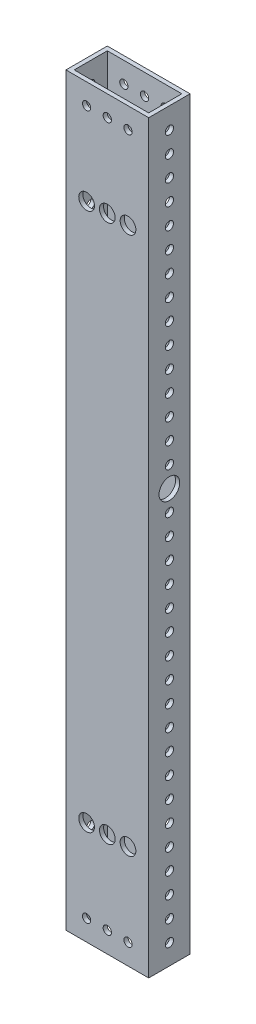
from build123d import *

# Parameters (mm, degrees)
SKETCH1_W           = 50.8
SKETCH1_H           = 25.4
SKETCH1_W_2         = 45.72
SKETCH1_H_2         = 20.32
BOSS_EXTRUDE1_DEPTH = 457.2
SKETCH3_R           = 2.54
SKETCH3_R_2         = 6.35
CUT_EXTRUDE1_DEPTH  = 457.2
SKETCH4_R           = 2.54
SKETCH4_R_2         = 4.826
CUT_EXTRUDE3_DEPTH  = 457.2


with BuildPart() as part:
    # Sketch1 → Boss-Extrude1 (new body)
    with BuildSketch(Plane(origin=(0, 0, 0), x_dir=(1, 0, 0), z_dir=(0, 1, 0))):
        with Locations((-21.472101782, 11.503789329)):
            Rectangle(SKETCH1_W, SKETCH1_H)
        with Locations((-21.472101782, 11.503789329)):
            Rectangle(SKETCH1_W_2, SKETCH1_H_2, mode=Mode.SUBTRACT)
    extrude(amount=BOSS_EXTRUDE1_DEPTH)

    # Sketch3 → Cut-Extrude1 (cut)
    with BuildSketch(Plane(origin=(3.927898218, 0, 0), x_dir=(0, 0, -1), z_dir=(1, 0, 0))):
        with Locations((11.503789329, 444.246)):
            Circle(SKETCH3_R)
        with Locations((11.503789329, 431.546)):
            Circle(SKETCH3_R)
        with Locations((11.503789329, 418.846)):
            Circle(SKETCH3_R)
        with Locations((11.503789329, 406.146)):
            Circle(SKETCH3_R)
        with Locations((11.503789329, 393.446)):
            Circle(SKETCH3_R)
        with Locations((11.503789329, 380.746)):
            Circle(SKETCH3_R)
        with Locations((11.503789329, 368.046)):
            Circle(SKETCH3_R)
        with Locations((11.503789329, 355.346)):
            Circle(SKETCH3_R)
        with Locations((11.503789329, 342.646)):
            Circle(SKETCH3_R)
        with Locations((11.503789329, 329.946)):
            Circle(SKETCH3_R)
        with Locations((11.503789329, 317.246)):
            Circle(SKETCH3_R)
        with Locations((11.503789329, 304.546)):
            Circle(SKETCH3_R)
        with Locations((11.503789329, 291.846)):
            Circle(SKETCH3_R)
        with Locations((11.503789329, 279.146)):
            Circle(SKETCH3_R)
        with Locations((11.503789329, 266.446)):
            Circle(SKETCH3_R)
        with Locations((11.503789329, 241.046)):
            Circle(SKETCH3_R)
        with Locations((11.503789329, 228.346)):
            Circle(SKETCH3_R)
        with Locations((11.503789329, 215.646)):
            Circle(SKETCH3_R)
        with Locations((11.503789329, 202.946)):
            Circle(SKETCH3_R)
        with Locations((11.503789329, 190.246)):
            Circle(SKETCH3_R)
        with Locations((11.503789329, 177.546)):
            Circle(SKETCH3_R)
        with Locations((11.503789329, 164.846)):
            Circle(SKETCH3_R)
        with Locations((11.503789329, 152.146)):
            Circle(SKETCH3_R)
        with Locations((11.503789329, 139.446)):
            Circle(SKETCH3_R)
        with Locations((11.503789329, 126.746)):
            Circle(SKETCH3_R)
        with Locations((11.503789329, 114.046)):
            Circle(SKETCH3_R)
        with Locations((11.503789329, 101.346)):
            Circle(SKETCH3_R)
        with Locations((11.503789329, 88.646)):
            Circle(SKETCH3_R)
        with Locations((11.503789329, 75.946)):
            Circle(SKETCH3_R)
        with Locations((11.503789329, 63.246)):
            Circle(SKETCH3_R)
        with Locations((11.503789329, 50.546)):
            Circle(SKETCH3_R)
        with Locations((11.503789329, 37.846)):
            Circle(SKETCH3_R)
        with Locations((11.503789329, 25.146)):
            Circle(SKETCH3_R)
        with Locations((11.503789329, 12.446)):
            Circle(SKETCH3_R)
        with Locations((11.503789329, 253.746)):
            Circle(SKETCH3_R_2)
    extrude(amount=-CUT_EXTRUDE1_DEPTH, mode=Mode.SUBTRACT)

    # Sketch4 → Cut-Extrude3 (cut)
    with BuildSketch(Plane(origin=(0, 0, -24.203789329), x_dir=(-1, 0, 0), z_dir=(0, 0, -1))):
        with Locations((34.172101782, 444.5)):
            Circle(SKETCH4_R)
        with Locations((21.472101782, 444.5)):
            Circle(SKETCH4_R)
        with Locations((8.772101782, 444.5)):
            Circle(SKETCH4_R)
        with Locations((8.772101782, 393.7)):
            Circle(SKETCH4_R_2)
        with Locations((21.472101782, 393.7)):
            Circle(SKETCH4_R_2)
        with Locations((34.172101782, 393.7)):
            Circle(SKETCH4_R_2)
        with Locations((34.172101782, 12.7)):
            Circle(SKETCH4_R)
        with Locations((21.472101782, 12.7)):
            Circle(SKETCH4_R)
        with Locations((8.772101782, 12.7)):
            Circle(SKETCH4_R)
        with Locations((34.172101782, 63.5)):
            Circle(SKETCH4_R_2)
        with Locations((21.472101782, 63.5)):
            Circle(SKETCH4_R_2)
        with Locations((8.772101782, 63.5)):
            Circle(SKETCH4_R_2)
    extrude(amount=-CUT_EXTRUDE3_DEPTH, mode=Mode.SUBTRACT)


solid = part.part
